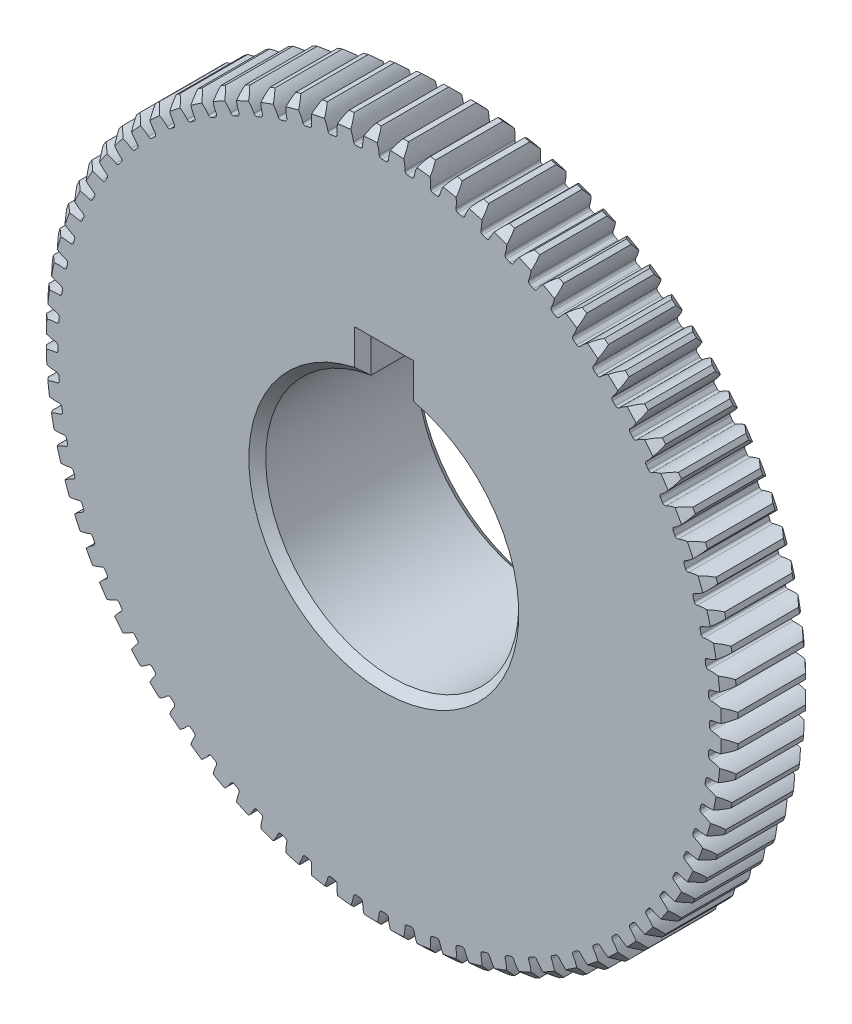
from build123d import *

# Parameters (mm, degrees)
SKETCH2_R                = 41
BOSS_EXTRUDE1_DEPTH      = 5
CUT_EXTRUDE1_DEPTH       = 59.197938108
FILLET1_R                = 0.3
CHAMFER1_SIZE            = 1
CIRPATTERN1_COUNT        = 80
FILLET1_OF_CIRPATTERN1_R = 0.3
CUT_EXTRUDE2_DEPTH       = 59.810048184
SKETCH5_R                = 22.5
BOSS_EXTRUDE2_DEPTH      = 10
CHAMFER2_SIZE            = 1
CHAMFER3_SIZE            = 1
CHAMFER4_SIZE            = 1


with BuildPart() as part:
    # Sketch2 → Boss-Extrude1 (new, symmetric)
    with BuildSketch(Plane.XY):
        Circle(SKETCH2_R)
    extrude(amount=BOSS_EXTRUDE1_DEPTH, both=True)

    # Sketch3 → Cut-Extrude1 (cut, symmetric)
    with BuildSketch(Plane.XY):
        with BuildLine():
            ThreePointArc((-2.231187989, 41.940693844), (-0.991366057, 40.466431591), (-0.529328256, 38.596370446))
            ThreePointArc((-0.529328256, 38.596370446), (0, 38.6), (0.529328256, 38.596370446))
            ThreePointArc((0.529328256, 38.596370446), (0.991366057, 40.466431591), (2.231187989, 41.940693844))
            ThreePointArc((2.231187989, 41.940693844), (0, 42), (-2.231187989, 41.940693844))
        make_face()
    cut_extrude1 = extrude(amount=CUT_EXTRUDE1_DEPTH, both=True, mode=Mode.SUBTRACT)

    # Fillet1
    fillet1_edges = [part.edges().sort_by_distance(p)[0] for p in [
        (-0.529328256, 38.596370446, 0),
        (0.529328256, 38.596370446, 0),
    ]]
    fillet(fillet1_edges, radius=FILLET1_R)

    # Chamfer1
    chamfer1_edges = [part.edges().sort_by_distance(p)[0] for p in [
        (-28.528177227, -29.447293664, -5),
        (-28.528177227, -29.447293664, 5),
    ]]
    chamfer(chamfer1_edges, length=CHAMFER1_SIZE)

    # CirPattern1: Cut-Extrude1 ×80 about axis
    cirpattern1_axis = Axis((0, 0, 0), (0, 0, 1))
    for i in range(1, CIRPATTERN1_COUNT):
        add(cut_extrude1.rotate(cirpattern1_axis, i * 360 / CIRPATTERN1_COUNT), mode=Mode.SUBTRACT)

    # Fillet1 of CirPattern1
    fillet1_of_cirpattern1_edges = [part.edges().sort_by_distance(p)[0] for p in [
        (-3.555932838, 38.4358601, 0),
        (-2.500539809, 38.518921333, 0),
        (-6.56061391, 38.038379896, 0),
        (-5.514991216, 38.203990261, 0),
        (-9.524846617, 37.406380431, 0),
        (-8.495440868, 37.653518886, 0),
        (-12.430355477, 36.543758191, 0),
        (-11.423513301, 36.870901045, 0),
        (-15.259227061, 35.45583153, 0),
        (-14.281155977, 35.860961838, 0),
        (-17.994020437, 34.149307878, 0),
        (-17.050750577, 34.629927877, 0),
        (-20.617874693, 32.632242386, 0),
        (-19.71522163, 33.185388895, 0),
        (-23.114612895, 30.913988269, 0),
        (-22.258141785, 31.536250955, 0),
        (-25.468841823, 29.005139134, 0),
        (-24.663833095, 29.692681541, 0),
        (-27.666046871, 26.917463672, 0),
        (-26.917463672, 27.666046871, 0),
        (-29.692681541, 24.663833095, 0),
        (-29.005139134, 25.468841823, 0),
        (-31.536250955, 22.258141785, 0),
        (-30.913988269, 23.114612895, 0),
        (-33.185388895, 19.71522163, 0),
        (-32.632242386, 20.617874693, 0),
        (-34.629927877, 17.050750577, 0),
        (-34.149307878, 17.994020437, 0),
        (-35.860961838, 14.281155977, 0),
        (-35.45583153, 15.259227061, 0),
        (-36.870901045, 11.423513301, 0),
        (-36.543758191, 12.430355477, 0),
        (-37.653518886, 8.495440868, 0),
        (-37.406380431, 9.524846617, 0),
        (-38.203990261, 5.514991216, 0),
        (-38.038379896, 6.56061391, 0),
        (-38.518921333, 2.500539809, 0),
        (-38.4358601, 3.555932838, 0),
        (-38.596370446, -0.529328256, 0),
        (-38.596370446, 0.529328256, 0),
        (-38.4358601, -3.555932838, 0),
        (-38.518921333, -2.500539809, 0),
        (-38.038379896, -6.56061391, 0),
        (-38.203990261, -5.514991216, 0),
        (-37.406380431, -9.524846617, 0),
        (-37.653518886, -8.495440868, 0),
        (-36.543758191, -12.430355477, 0),
        (-36.870901045, -11.423513301, 0),
        (-35.45583153, -15.259227061, 0),
        (-35.860961838, -14.281155977, 0),
        (-34.149307878, -17.994020437, 0),
        (-34.629927877, -17.050750577, 0),
        (-32.632242386, -20.617874693, 0),
        (-33.185388895, -19.71522163, 0),
        (-30.913988269, -23.114612895, 0),
        (-31.536250955, -22.258141785, 0),
        (-29.005139134, -25.468841823, 0),
        (-29.692681541, -24.663833095, 0),
        (-26.917463672, -27.666046871, 0),
        (-27.666046871, -26.917463672, 0),
        (-24.663833095, -29.692681541, 0),
        (-25.468841823, -29.005139134, 0),
        (-22.258141785, -31.536250955, 0),
        (-23.114612895, -30.913988269, 0),
        (-19.71522163, -33.185388895, 0),
        (-20.617874693, -32.632242386, 0),
        (-17.050750577, -34.629927877, 0),
        (-17.994020437, -34.149307878, 0),
        (-14.281155977, -35.860961838, 0),
        (-15.259227061, -35.45583153, 0),
        (-11.423513301, -36.870901045, 0),
        (-12.430355477, -36.543758191, 0),
        (-8.495440868, -37.653518886, 0),
        (-9.524846617, -37.406380431, 0),
        (-5.514991216, -38.203990261, 0),
        (-6.56061391, -38.038379896, 0),
        (-2.500539809, -38.518921333, 0),
        (-3.555932838, -38.4358601, 0),
        (0.529328256, -38.596370446, 0),
        (-0.529328256, -38.596370446, 0),
        (3.555932838, -38.4358601, 0),
        (2.500539809, -38.518921333, 0),
        (6.56061391, -38.038379896, 0),
        (5.514991216, -38.203990261, 0),
        (9.524846617, -37.406380431, 0),
        (8.495440868, -37.653518886, 0),
        (12.430355477, -36.543758191, 0),
        (11.423513301, -36.870901045, 0),
        (15.259227061, -35.45583153, 0),
        (14.281155977, -35.860961838, 0),
        (17.994020437, -34.149307878, 0),
        (17.050750577, -34.629927877, 0),
        (20.617874693, -32.632242386, 0),
        (19.71522163, -33.185388895, 0),
        (23.114612895, -30.913988269, 0),
        (22.258141785, -31.536250955, 0),
        (25.468841823, -29.005139134, 0),
        (24.663833095, -29.692681541, 0),
        (27.666046871, -26.917463672, 0),
        (26.917463672, -27.666046871, 0),
        (29.692681541, -24.663833095, 0),
        (29.005139134, -25.468841823, 0),
        (31.536250955, -22.258141785, 0),
        (30.913988269, -23.114612895, 0),
        (33.185388895, -19.71522163, 0),
        (32.632242386, -20.617874693, 0),
        (34.629927877, -17.050750577, 0),
        (34.149307878, -17.994020437, 0),
        (35.860961838, -14.281155977, 0),
        (35.45583153, -15.259227061, 0),
        (36.870901045, -11.423513301, 0),
        (36.543758191, -12.430355477, 0),
        (37.653518886, -8.495440868, 0),
        (37.406380431, -9.524846617, 0),
        (38.203990261, -5.514991216, 0),
        (38.038379896, -6.56061391, 0),
        (38.518921333, -2.500539809, 0),
        (38.4358601, -3.555932838, 0),
        (38.596370446, 0.529328256, 0),
        (38.596370446, -0.529328256, 0),
        (38.4358601, 3.555932838, 0),
        (38.518921333, 2.500539809, 0),
        (38.038379896, 6.56061391, 0),
        (38.203990261, 5.514991216, 0),
        (37.406380431, 9.524846617, 0),
        (37.653518886, 8.495440868, 0),
        (36.543758191, 12.430355477, 0),
        (36.870901045, 11.423513301, 0),
        (35.45583153, 15.259227061, 0),
        (35.860961838, 14.281155977, 0),
        (34.149307878, 17.994020437, 0),
        (34.629927877, 17.050750577, 0),
        (32.632242386, 20.617874693, 0),
        (33.185388895, 19.71522163, 0),
        (30.913988269, 23.114612895, 0),
        (31.536250955, 22.258141785, 0),
        (29.005139134, 25.468841823, 0),
        (29.692681541, 24.663833095, 0),
        (26.917463672, 27.666046871, 0),
        (27.666046871, 26.917463672, 0),
        (24.663833095, 29.692681541, 0),
        (25.468841823, 29.005139134, 0),
        (22.258141785, 31.536250955, 0),
        (23.114612895, 30.913988269, 0),
        (19.71522163, 33.185388895, 0),
        (20.617874693, 32.632242386, 0),
        (17.050750577, 34.629927877, 0),
        (17.994020437, 34.149307878, 0),
        (14.281155977, 35.860961838, 0),
        (15.259227061, 35.45583153, 0),
        (11.423513301, 36.870901045, 0),
        (12.430355477, 36.543758191, 0),
        (8.495440868, 37.653518886, 0),
        (9.524846617, 37.406380431, 0),
        (5.514991216, 38.203990261, 0),
        (6.56061391, 38.038379896, 0),
        (2.500539809, 38.518921333, 0),
        (3.555932838, 38.4358601, 0),
    ]]
    fillet(fillet1_of_cirpattern1_edges, radius=FILLET1_OF_CIRPATTERN1_R)

    # Sketch4 → Cut-Extrude2 (cut, through all)
    with BuildSketch(Plane.XY.offset(5)):
        with BuildLine():
            Line((2.5, 18.790199458), (-2.5, 18.790199458))
            Line((-2.5, 18.790199458), (-2.5, 14.790199458))
            ThreePointArc((-2.5, 14.790199458), (0, -15), (2.5, 14.790199458))
            Line((2.5, 14.790199458), (2.5, 18.790199458))
        make_face()
    extrude(amount=-CUT_EXTRUDE2_DEPTH, mode=Mode.SUBTRACT)

    # Sketch5 → Boss-Extrude2 (add)
    with BuildSketch(Plane(origin=(0, 0, -5), x_dir=(-1, 0, 0), z_dir=(0, 0, -1))):
        with Locations(Location((0, 0, 0), (0, 0, 180))):
            Circle(SKETCH5_R)
        with BuildLine():
            Line((2.5, 18.790199458), (2.5, 14.790199458))
            ThreePointArc((2.5, 14.790199458), (0, -15), (-2.5, 14.790199458))
            Line((-2.5, 14.790199458), (-2.5, 18.790199458))
            Line((-2.5, 18.790199458), (2.5, 18.790199458))
        make_face(mode=Mode.SUBTRACT)
    extrude(amount=BOSS_EXTRUDE2_DEPTH)

    # Chamfer2
    chamfer2_edges = [part.edges().sort_by_distance(p)[0] for p in [
        (-22.5, 0, -5),
        (-22.5, 0, -15),
    ]]
    chamfer(chamfer2_edges, length=CHAMFER2_SIZE)

    # Chamfer3
    chamfer3_edges = [part.edges().sort_by_distance(p)[0] for p in [
        (0, -15, 5),
        (2.5, 16.790199458, 5),
        (0, 18.790199458, 5),
        (-2.5, 16.790199458, 5),
    ]]
    chamfer(chamfer3_edges, length=CHAMFER3_SIZE)

    # Chamfer4
    chamfer4_edges = [part.edges().sort_by_distance(p)[0] for p in [
        (0, -15, -15),
        (-2.5, 16.790199458, -15),
        (0, 18.790199458, -15),
        (2.5, 16.790199458, -15),
    ]]
    chamfer(chamfer4_edges, length=CHAMFER4_SIZE)


solid = part.part
